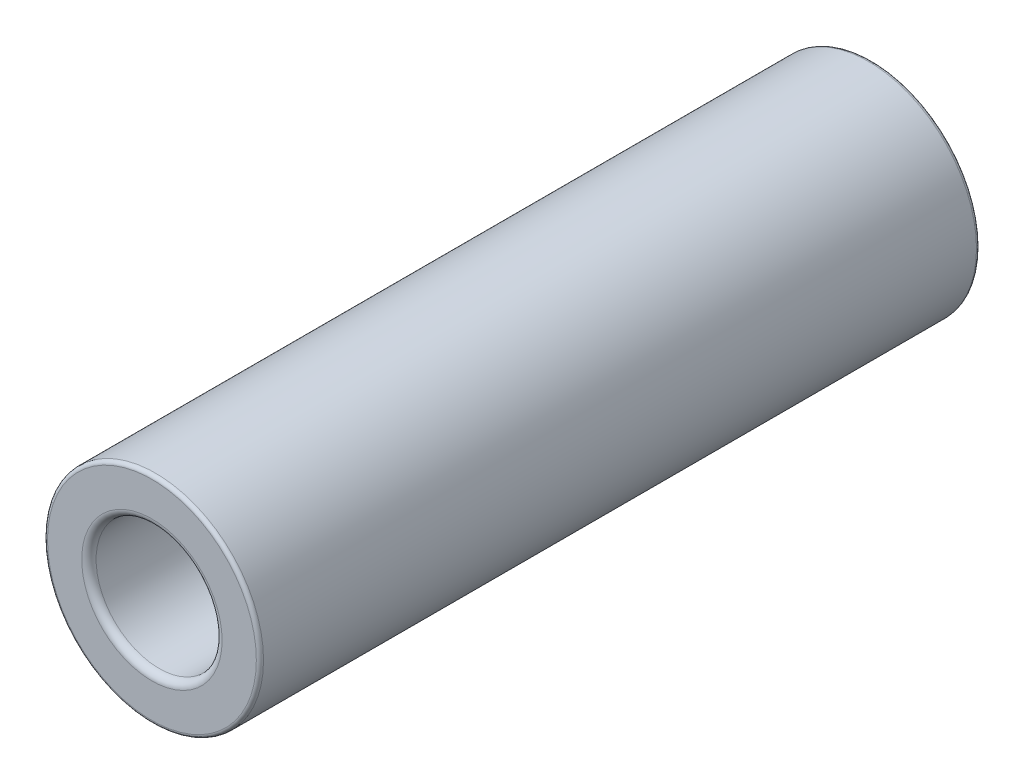
from build123d import *

# Parameters (mm, degrees)
CROQUIS1_R              = 3
CROQUIS1_R_2            = 1.75
SALIENTE_EXTRUIR2_DEPTH = 20
REDONDEO5_R             = 0.1
REDONDEO6_R             = 0.2


with BuildPart() as part:
    # Croquis1 → Saliente-Extruir2 (new body)
    with BuildSketch(Plane.XY):
        Circle(CROQUIS1_R)
        Circle(CROQUIS1_R_2, mode=Mode.SUBTRACT)
    extrude(amount=SALIENTE_EXTRUIR2_DEPTH)

    # Redondeo5
    redondeo5_edges = [part.edges().sort_by_distance(p)[0] for p in [
        (-3, 0, 0),
        (-3, 0, 20),
    ]]
    fillet(redondeo5_edges, radius=REDONDEO5_R)

    # Redondeo6
    redondeo6_edges = [part.edges().sort_by_distance(p)[0] for p in [
        (-1.75, 0, 0),
        (-1.75, 0, 20),
    ]]
    fillet(redondeo6_edges, radius=REDONDEO6_R)


solid = part.part
